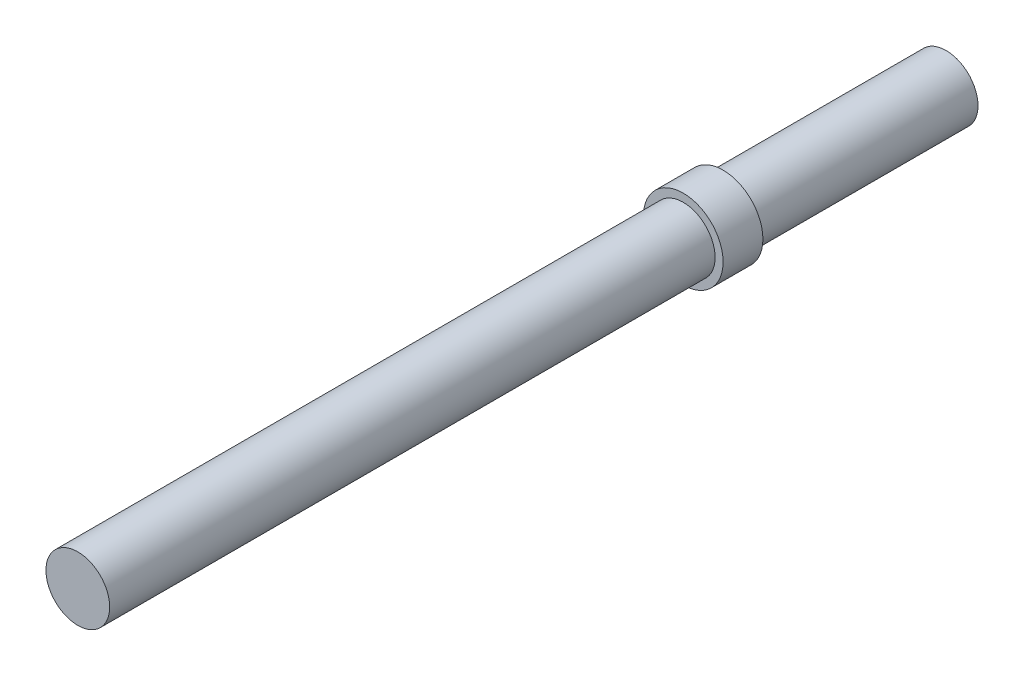
from build123d import *

# Parameters (mm, degrees)
CROQUIS1_R              = 4
SALIENTE_EXTRUIR1_DEPTH = 54.5
CROQUIS2_R              = 5
SALIENTE_EXTRUIR2_DEPTH = 5


with BuildPart() as part:
    # Croquis1 → Saliente-Extruir1 (new, symmetric)
    with BuildSketch(Plane.XY):
        Circle(CROQUIS1_R)
    extrude(amount=SALIENTE_EXTRUIR1_DEPTH, both=True)

    # Croquis2 → Saliente-Extruir2 (add)
    with BuildSketch(Plane.XY.offset(-26.5)):
        Circle(CROQUIS2_R)
    extrude(amount=SALIENTE_EXTRUIR2_DEPTH)


solid = part.part
